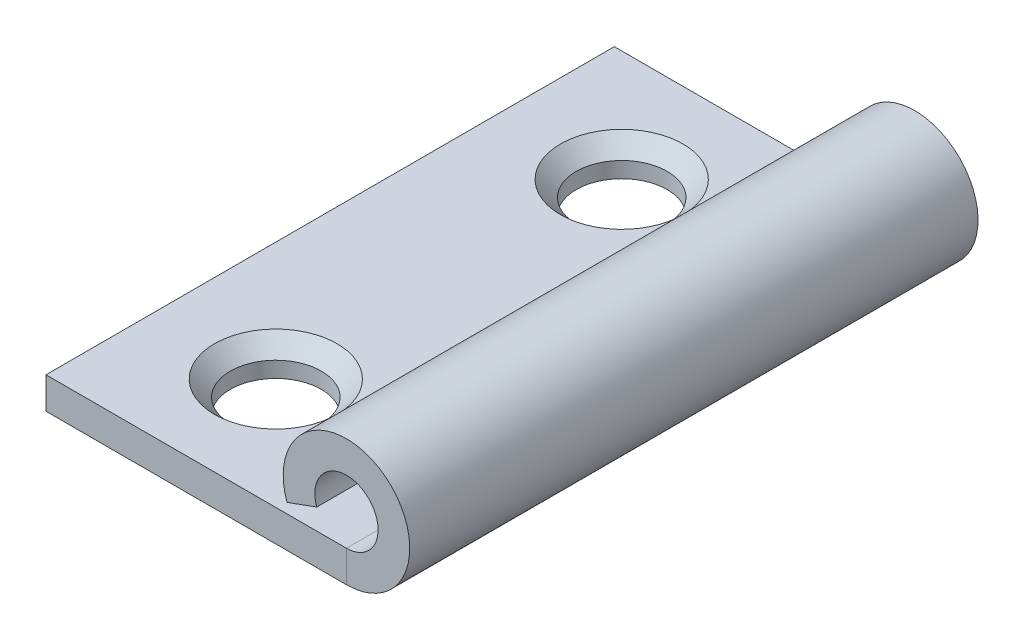
from build123d import *

# Parameters (mm, degrees)
SKETCH1_W          = 23.368
SKETCH1_H          = 36.5125
SKETCH1_R          = 2.921
BASE_FLANGE1_DEPTH = 2.032
HEM1_START         = -18.25625
HEM1_DEPTH         = 36.5125
HEM1_2_DEPTH       = 36.5125
CHAMFER1_SIZE      = 1.016


# Read off the part's stored shape, not the designer's step: Hem1
# Sheet-metal steps are written as plain solids
with BuildPart() as part:
    # Sketch1 → Base-Flange1 (new body)
    with BuildSketch(Plane(origin=(0, 0, 0), x_dir=(1, 0, 0), z_dir=(0, 1, 0))):
        Rectangle(SKETCH1_W, SKETCH1_H)
        with Locations(Location((-4.064, -11.1125, 0), (0, 0, 270))):
            Circle(SKETCH1_R, mode=Mode.SUBTRACT)
        with Locations(Location((-4.064, 11.1125, 0), (0, 0, 270))):
            Circle(SKETCH1_R, mode=Mode.SUBTRACT)
    extrude(amount=BASE_FLANGE1_DEPTH)

    # Hem1 outline → Hem1 (cut)
    with BuildSketch(Plane.XY.offset(HEM1_START)):
        with BuildLine():
            Line((11.684, 2.032), (11.139527241, 2.032))
            ThreePointArc((11.139527241, 2.032), (9.652, 0.544472759), (7.62, 0))
            Line((7.62, 0), (11.684, 0))
            Line((11.684, 0), (11.684, 2.032))
        make_face()
    extrude(amount=HEM1_DEPTH, mode=Mode.SUBTRACT)

    # Hem1 2 outline → Hem1 2 (add)
    with BuildSketch(Plane.XY.offset(HEM1_START)):
        with BuildLine():
            Line((3.801089189, 2.674030138), (5.710544595, 3.369015069))
            ThreePointArc((5.710544595, 3.369015069), (8.785507319, 5.728516954), (7.62, 2.032))
            Line((7.62, 2.032), (11.139527241, 2.032))
            ThreePointArc((11.139527241, 2.032), (7.974200939, 8.112535253), (3.801089189, 2.674030138))
        make_face()
    extrude(amount=HEM1_2_DEPTH)

    # Chamfer1
    chamfer1_edges = [part.edges().sort_by_distance(p)[0] for p in [
        (-4.064, 2.032, 8.1915),
        (-4.064, 2.032, -14.0335),
    ]]
    chamfer(chamfer1_edges, length=CHAMFER1_SIZE)


solid = part.part
